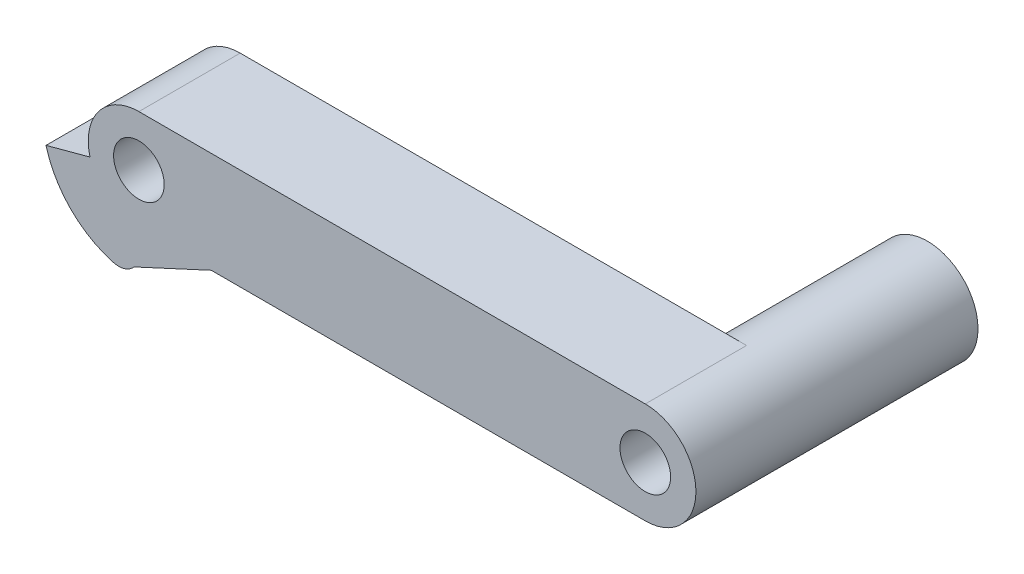
from build123d import *
from build123d.topology import SkipClean

# Parameters (mm, degrees)
EXTRUDE_1_DEPTH     = 10
SKETCH_2_R          = 2.500000000000002
SKETCH_2_R_2        = 2.5
CUT_EXTRUDE_1_DEPTH = 10
EXTRUDE_START       = -27.850000000000005
SKETCH_4_R          = 4.999999999999997
EXTRUDE_2_DEPTH     = 27.850000000000005
EXTRUDE_START_2     = -10
EXTRUDE_3_DEPTH     = 10
FILLET_1_R          = 2
CHAMFER_START       = 4
CHAMFER_1_OUTLINE_W = 8.394855713999998
CHAMFER_1_OUTLINE_H = 10
CHAMFER_1_DEPTH     = 3.536622653
SKETCH_6_R          = 2.500000000000002
CUT_EXTRUDE_2_DEPTH = 8
SKETCH_8_R          = 1.7500000000000036
CUT_EXTRUDE_4_DEPTH = 10.85
SKETCH_9_R          = 2.500000000000002
CUT_EXTRUDE_5_DEPTH = 9
CUT_EXTRUDE_START   = -3
CUT_EXTRUDE_6_DEPTH = 4
FILLET_2_R          = 1
EXTRUDE_START_3     = 4
EXTRUDE_4_DEPTH     = 4
SKETCH_12_R         = 2.5
EXTRUDE_5_DEPTH     = 4


with BuildPart() as part:
    # 草图1 → 凸台-拉伸1 (new body)
    with BuildSketch(Plane.XY):
        with BuildLine():
            Line((0, 5), (50, 5.000000000000001))
            ThreePointArc((50, 5.000000000000001), (55, 0), (50, -4.999999999999997))
            Line((50, -4.999999999999997), (0, -5))
            ThreePointArc((0, -5), (-5, 6.1e-16), (0, 5))
        make_face()
    extrude(amount=EXTRUDE_1_DEPTH)

    # 草图2 → 切除-拉伸1 (cut)
    with BuildSketch(Plane.XY.offset(10)):
        with Locations((50, 0)):
            Circle(SKETCH_2_R)
        Circle(SKETCH_2_R_2)
    extrude(amount=-CUT_EXTRUDE_1_DEPTH, mode=Mode.SUBTRACT)

    # 草图4 → 凸台-拉伸2 (add)
    with SkipClean():  # the faces are left unmerged after this step: merging them gives an invalid solid
        with BuildSketch(Plane.XY.offset(10).offset(EXTRUDE_START)):
            with Locations(Location((50, 0, 0), (0, 0, 270))):
                Circle(SKETCH_4_R)
        extrude(amount=EXTRUDE_2_DEPTH)

    # 草图5 → 凸台-拉伸3 (add)
    with SkipClean():  # the faces are left unmerged after this step: merging them gives an invalid solid
        with BuildSketch(Plane.XY.offset(10).offset(EXTRUDE_START_2)):
            with BuildLine():
                Line((-9.171946933133274, -2.4749524148530857), (-4.827340491122777, -1.3026065341332034))
                ThreePointArc((-4.827340491122777, -1.3026065341332034), (-3.0403097974823012, -3.9694478627805583), (5.411e-14, -5))
                Line((5.411e-14, -5), (1.028e-13, -9.5))
                ThreePointArc((1.028e-13, -9.5), (-5.7765886152163715, -7.541950939283059), (-9.171946933133274, -2.4749524148530857))
            make_face()
        extrude(amount=EXTRUDE_3_DEPTH)

    # 圆角1
    fillet_1_edges = [part.edges().sort_by_distance(p)[0] for p in [
        (1.028e-13, -9.5, 5),
    ]]
    fillet(fillet_1_edges, radius=FILLET_1_R)

    # 倒角1: read off the stored shape, not the designer's step
    # 倒角1 outline → 倒角1 (add)
    with BuildSketch(Plane(origin=(0, 0, 0), x_dir=(0.9076430982816491, 0.41974278569343915, 0), z_dir=(0.41974278569343915, -0.9076430982816494, 0)).offset(CHAMFER_START)):
        with Locations((0.18755170199999993, 5)):
            Rectangle(CHAMFER_1_OUTLINE_W, CHAMFER_1_OUTLINE_H)
    extrude(amount=CHAMFER_1_DEPTH)

    # 草图6 → 切除-拉伸2 (cut)
    with BuildSketch(Plane(origin=(0, 0, -17.850000000000005), x_dir=(-1, 0, 0), z_dir=(0, 0, -1))):
        with Locations((-50, 0)):
            Circle(SKETCH_6_R)
    extrude(amount=-CUT_EXTRUDE_2_DEPTH, mode=Mode.SUBTRACT)

    # 草图8 → 切除-拉伸4 (cut)
    with BuildSketch(Plane(origin=(0, 0, -9.850000000000005), x_dir=(-1, 0, 0), z_dir=(0, 0, -1))):
        with Locations((-50, 0)):
            Circle(SKETCH_8_R)
    extrude(amount=-CUT_EXTRUDE_4_DEPTH, mode=Mode.SUBTRACT)

    # 草图9 → 切除-拉伸5 (cut)
    with BuildSketch(Plane(origin=(0, 0, 1.0000000000000009), x_dir=(-1, 0, 0), z_dir=(0, 0, -1))):
        with Locations((-50, 0)):
            Circle(SKETCH_9_R)
    extrude(amount=-CUT_EXTRUDE_5_DEPTH, mode=Mode.SUBTRACT)

    # 草图10 → 切除-拉伸6 (cut)
    with BuildSketch(Plane(origin=(0, 0, 0), x_dir=(-1, 0, 0), z_dir=(0, 0, -1)).offset(CUT_EXTRUDE_START)):
        with BuildLine():
            Line((3.5355339059327444, -3.535533905932731), (6.717514421272216, -6.717514421272188))
            ThreePointArc((6.717514421272216, -6.717514421272188), (8.223051661510107, -4.757249349375738), (9.171946933133274, -2.474952414853084))
            Line((9.171946933133274, -2.474952414853084), (4.827340491122777, -1.3026065341332023))
            ThreePointArc((4.827340491122777, -1.3026065341332023), (-4.327921927110582, 2.503815447039863), (3.5355339059327444, -3.535533905932731))
        make_face()
    extrude(amount=-CUT_EXTRUDE_6_DEPTH, mode=Mode.SUBTRACT)

    # 圆角2
    fillet_2_edges = [part.edges().sort_by_distance(p)[0] for p in [
        (-3.1e-16, 5, 5),
    ]]
    fillet(fillet_2_edges, radius=FILLET_2_R)

    # 草图11 → 凸台-拉伸4 (add)
    with BuildSketch(Plane(origin=(0, 0, 7), x_dir=(-1, 0, 0), z_dir=(0, 0, -1)).offset(EXTRUDE_START_3)):
        with BuildLine():
            Line((8.197358015291606, -4.801387462925119), (3.5463669464222503, -3.5463669464222334))
            Line((3.5463669464222494, -3.5463669464222356), (6.717514421272216, -6.717514421272188))
            ThreePointArc((6.717514421272217, -6.71751442127219), (7.518725994466674, -5.8067856357998195), (8.197358015291606, -4.801387462925119))
        make_face()
    extrude(amount=-EXTRUDE_4_DEPTH)

    # 草图12 → 凸台-拉伸5 (add)
    with BuildSketch(Plane(origin=(0, 0, 7), x_dir=(-1, 0, 0), z_dir=(0, 0, -1)).offset(EXTRUDE_START_3)):
        with BuildLine():
            Line((3.546366946422246, -3.546366946422232), (8.197358015291606, -4.80138746292512))
            ThreePointArc((8.197358015291606, -4.80138746292512), (8.762206548927544, -3.6706588501155046), (9.171946933133276, -2.474952414853084))
            Line((9.171946933133276, -2.474952414853084), (4.827340491122777, -1.3026065341332018))
            ThreePointArc((4.827340491122777, -1.3026065341332018), (3.9694478627805414, 3.040309797482321), (3.1e-16, 5))
            Line((3.1e-16, 5), (-4.47213595499958, 5))
            ThreePointArc((-4.47213595499958, 5), (-3.5592650258243026, 4.408248290463862), (-3.7267799624996503, 3.333333333333333))
            ThreePointArc((-3.7267799624996503, 3.333333333333333), (-3.4357645511885355, -3.6325641011269494), (3.535533905932743, -3.5355339059327324))
            Line((3.535533905932743, -3.5355339059327324), (3.546366946422246, -3.546366946422232))
        make_face()
        with Locations(Location((0, 0, 0), (0, 0, 180))):
            Circle(SKETCH_12_R, mode=Mode.SUBTRACT)
    extrude(amount=-EXTRUDE_5_DEPTH)


solid = part.part
